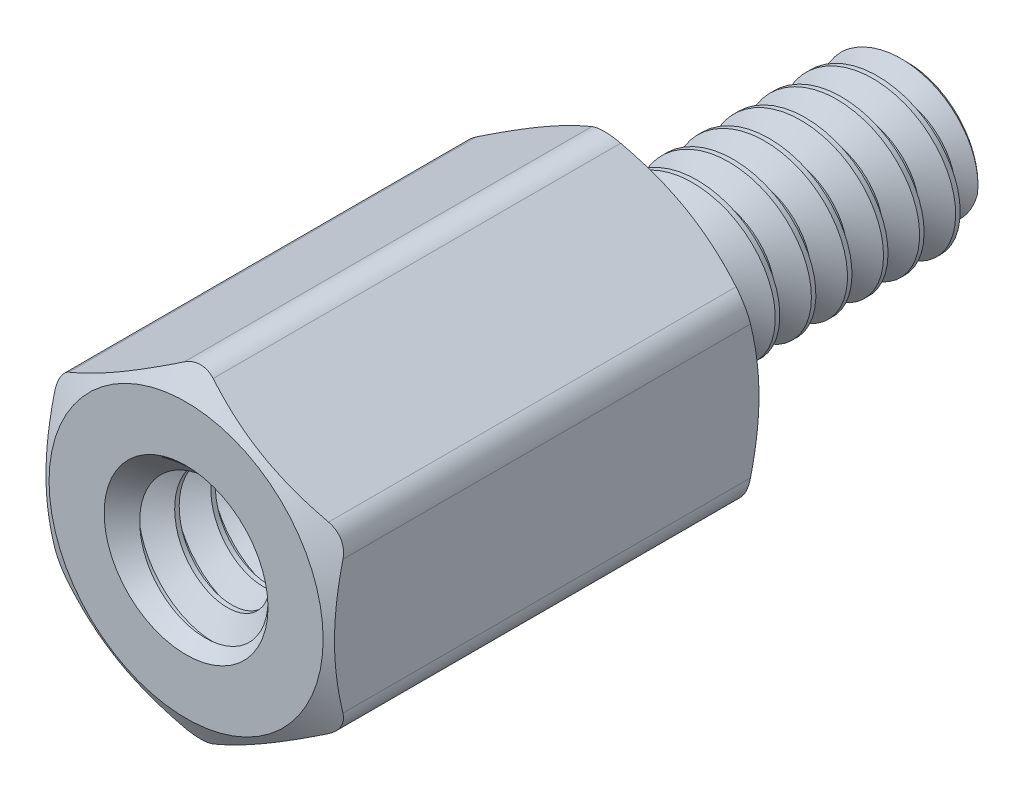
from build123d import *

# Parameters (mm, degrees)
SKETCH4_R              = 2.4638
BOSS_EXTRUDE1_DEPTH    = 9.525
SKETCH5_OUTSIDE_W      = 73.036
SKETCH5_OUTSIDE_H      = 74.018
SKETCH5_OUTSIDE_R      = 3.01625
CUT_EXTRUDE1_DEPTH     = 17.599309725
CUT_EXTRUDE1_DRAFT     = -60
SKETCH6_OUTSIDE_W      = 52.562
SKETCH6_OUTSIDE_H      = 53.544
SKETCH6_OUTSIDE_R      = 3.01625
CUT_EXTRUDE2_DEPTH     = 11.688642726
CUT_EXTRUDE2_DRAFT     = -60
FILLET1_R              = 0.635
CUT_SWEEP1_PITCH       = 0.79375
CUT_SWEEP1_HEIGHT      = 6.1595
CUT_SWEEP1_RADIUS      = 1.7526
CUT_SWEEP1_START_ANGLE = 90
SKETCH9_R              = 1.9510375
BOSS_EXTRUDE2_DEPTH    = 5.5626
SKETCH10_W             = 5.5626
SKETCH10_H             = 1.7526
CUT_SWEEP2_PITCH       = 0.79375
SKETCH13_R             = 1.8034
CUT_EXTRUDE3_DEPTH     = 1.190625
CUT_EXTRUDE3_DRAFT     = -44.758685511


with BuildPart() as part:
    # Sketch3 → Revolve1 (revolve)
    with BuildSketch(Plane(origin=(0, 0, 0), x_dir=(0, 0, -1), z_dir=(1, 0, 0))):
        with BuildLine():
            Line((-3.9624, 1.5541625), (-3.9624, 0))
            Line((-3.9624, 0), (6.35, 0))
            Line((6.35, 0), (6.35, 1.5541625))
            Line((6.35, 1.5541625), (6.1515625, 1.7526))
            Line((6.1515625, 1.7526), (1.05965625, 1.7526))
            Line((1.05965625, 1.7526), (0.762, 1.237044252))
            Line((0.762, 1.237044252), (0.1984375, 1.237044252))
            ThreePointArc((0.1984375, 1.237044252), (0.058120998, 1.29516525), (0, 1.435481752))
            Line((0, 1.435481752), (0, 3.175))
            Line((0, 3.175), (-9.525, 3.175))
            Line((-9.525, 3.175), (-9.525, 1.9510375))
            Line((-9.525, 1.9510375), (-9.3265625, 1.7526))
            Line((-9.3265625, 1.7526), (-4.1608375, 1.7526))
            Line((-4.1608375, 1.7526), (-3.9624, 1.5541625))
        make_face()
    revolve(axis=Axis((0, 0, -6.35), (0, 0, 1)))

    # Sketch4 → Boss-Extrude1 (add)
    with BuildSketch(Plane.XY.offset(9.525)):
        Polygon((-3.175, 1.833087105), (-3.175, -1.833087105), (0, -3.666174209), (3.175, -1.833087105), (3.175, 1.833087105), (0, 3.666174209), align=None)
        Circle(SKETCH4_R, mode=Mode.SUBTRACT)
    extrude(amount=-BOSS_EXTRUDE1_DEPTH)


with BuildPart() as cut_extrude1_tool:
    # Sketch5 outside → Cut-Extrude1 (with draft: the straight prism first)
    with BuildSketch(Plane.XY.offset(9.525)):
        Rectangle(SKETCH5_OUTSIDE_W, SKETCH5_OUTSIDE_H)
        Circle(SKETCH5_OUTSIDE_R, mode=Mode.SUBTRACT)
    extrude(amount=-CUT_EXTRUDE1_DEPTH)
    # Cut-Extrude1: the draft: its side faces are tilted about the plane it starts from
    cut_extrude1_sides = [cut_extrude1_tool.faces().sort_by_distance(p)[0] for p in [
        (0, -37.009, 0.725345138),
        (36.518, 0, 0.725345138),
        (0, 37.009, 0.725345138),
        (-36.518, 0, 0.725345138),
        (-3.01625, 0, 0.725345138),
    ]]
    draft(cut_extrude1_sides, Plane.XY.offset(9.525), CUT_EXTRUDE1_DRAFT)


with BuildPart() as part_1:
    add(part.part)

    # Cut-Extrude1: cut by cut_extrude1_tool
    add(cut_extrude1_tool.part, mode=Mode.SUBTRACT)


with BuildPart() as cut_extrude2_tool:
    # Sketch6 outside → Cut-Extrude2 (with draft: the straight prism first)
    with BuildSketch(Plane(origin=(0, 0, 0), x_dir=(-1, 0, 0), z_dir=(0, 0, -1))):
        Rectangle(SKETCH6_OUTSIDE_W, SKETCH6_OUTSIDE_H)
        Circle(SKETCH6_OUTSIDE_R, mode=Mode.SUBTRACT)
    extrude(amount=-CUT_EXTRUDE2_DEPTH)
    # Cut-Extrude2: the draft: its side faces are tilted about the plane it starts from
    cut_extrude2_sides = [cut_extrude2_tool.faces().sort_by_distance(p)[0] for p in [
        (0, -26.772, 5.844321363),
        (-26.281, 0, 5.844321363),
        (0, 26.772, 5.844321363),
        (26.281, 0, 5.844321363),
        (3.01625, 0, 5.844321363),
    ]]
    draft(cut_extrude2_sides, Plane(origin=(0, 0, 0), x_dir=(-1, 0, 0), z_dir=(0, 0, -1)), CUT_EXTRUDE2_DRAFT)


with BuildPart() as part_2:
    add(part_1.part)

    # Cut-Extrude2: cut by cut_extrude2_tool
    add(cut_extrude2_tool.part, mode=Mode.SUBTRACT)

    # Fillet1
    fillet1_edges = [part_2.edges().sort_by_distance(p)[0] for p in [
        (0, 3.666174209, 4.7625),
        (-3.175, -1.833087105, 4.7625),
        (0, -3.666174209, 4.7625),
        (3.175, -1.833087105, 4.7625),
        (3.175, 1.833087105, 4.7625),
        (-3.175, 1.833087105, 4.7625),
    ]]
    fillet(fillet1_edges, radius=FILLET1_R)

    # Cut-Sweep1: sweep along a helix
    with BuildLine() as cut_sweep1_path:
        add(Helix(CUT_SWEEP1_PITCH, CUT_SWEEP1_HEIGHT, CUT_SWEEP1_RADIUS, center=(0, 0, -6.35), direction=(0, 0, 1), mode=Mode.PRIVATE).rotate(Axis((0, 0, -6.35), (0, 0, 1)), CUT_SWEEP1_START_ANGLE))
    # Sketch7 → Cut-Sweep1 (sweep, cut)
    with BuildSketch(Plane.ZY):
        Polygon((-6.64765625, 1.237044252), (-6.746875, 1.237044252), (-7.069335938, 1.795562979), (-6.325195313, 1.795562979), align=None)
    sweep(path=cut_sweep1_path.line, is_frenet=True, mode=Mode.SUBTRACT)

    # Sketch9 → Boss-Extrude2 (add)
    with BuildSketch(Plane.XY.offset(3.9624)):
        Circle(SKETCH9_R)
    extrude(amount=BOSS_EXTRUDE2_DEPTH)


with BuildPart() as body_2:
    # Sketch10 → Revolve2 (revolve)
    with BuildSketch(Plane(origin=(0, 0, 0), x_dir=(0, 0, -1), z_dir=(1, 0, 0))):
        with Locations((-6.7437, 0.8763)):
            Rectangle(SKETCH10_W, SKETCH10_H)
    revolve(axis=Axis((0, 0, -6.35), (0, 0, 1)))

    # Cut-Sweep2: the profile of Sketch12 profile screwed along a right-hand helix of 8.008 turns, 8 arcs to a turn; built about Z, then put on its axis
    cut_sweep2_z = Axis((0, 0, 0), (0, 0, 1))
    cut_sweep2_corners = [(1.236744252, 0, -0.396701795), (1.236744252, 0, -0.297829455), (1.795562979, 0, 0.024804687), (1.795562979, 0, -0.719335938)]
    with BuildLine(mode=Mode.PRIVATE) as cut_sweep2_profile:
        Line(cut_sweep2_corners[0], cut_sweep2_corners[1])
        Line(cut_sweep2_corners[1], cut_sweep2_corners[2])
        Line(cut_sweep2_corners[2], cut_sweep2_corners[3])
        Line(cut_sweep2_corners[3], cut_sweep2_corners[0])
    cut_sweep2_cap = Face(cut_sweep2_profile.wire())
    cut_sweep2_turn_angles = [0, 22.5, 45, 67.5, 90, 112.5, 135, 157.5, 180, 202.5, 225, 247.5, 270, 292.5, 315, 337.5, 360]
    cut_sweep2_turn_weights = [1, 0.9238795325112867, 1, 0.9238795325112867, 1, 0.9238795325112867, 1, 0.9238795325112867, 1, 0.9238795325112867, 1, 0.9238795325112867, 1, 0.9238795325112867, 1, 0.9238795325112867, 1]
    cut_sweep2_turn_rails = [Edge.make_bspline([Vector(p[0], p[1], 0).rotate(cut_sweep2_z, cut_sweep2_turn_angles[k]) / cut_sweep2_turn_weights[k] + Vector(0, 0, p[2] + CUT_SWEEP2_PITCH * cut_sweep2_turn_angles[k] / 360) for k in range(17)], [0, 0, 0, 1, 1, 2, 2, 3, 3, 4, 4, 5, 5, 6, 6, 7, 7, 8, 8, 8], 2, cut_sweep2_turn_weights) for p in cut_sweep2_corners]
    cut_sweep2_turn_sides = [Face.make_surface_from_curves(cut_sweep2_turn_rails[p[0]], cut_sweep2_turn_rails[p[1]]) for p in [(0, 1), (1, 2), (2, 3), (3, 0)]]
    cut_sweep2_last_angles = [2880, 2881.44, 2882.88]
    cut_sweep2_last_weights = [1, 0.9996841892832979, 1]
    cut_sweep2_last_rails = [Edge.make_bspline([Vector(p[0], p[1], 0).rotate(cut_sweep2_z, cut_sweep2_last_angles[k]) / cut_sweep2_last_weights[k] + Vector(0, 0, p[2] + CUT_SWEEP2_PITCH * cut_sweep2_last_angles[k] / 360) for k in range(3)], [0, 0, 0, 1, 1, 1], 2, cut_sweep2_last_weights) for p in cut_sweep2_corners]
    cut_sweep2_last_sides = [Face.make_surface_from_curves(cut_sweep2_last_rails[p[0]], cut_sweep2_last_rails[p[1]]) for p in [(0, 1), (1, 2), (2, 3), (3, 0)]]
    cut_sweep2 = Plane(origin=(0, 0, 9.525), x_dir=(0, 1, 0), z_dir=(0, 0, -1)) * Solid(Shell([*[p.moved(Location((0, 0, CUT_SWEEP2_PITCH * i))) for i in range(8) for p in cut_sweep2_turn_sides], *cut_sweep2_last_sides, cut_sweep2_cap, cut_sweep2_cap.rotate(cut_sweep2_z, 2882.88).moved(Location((0, 0, CUT_SWEEP2_PITCH * 2882.88 / 360)))]))
    add(cut_sweep2, mode=Mode.SUBTRACT)


with BuildPart() as part_3:
    add(part_2.part)

    # Combine1: cut body 2
    add(body_2.part, mode=Mode.SUBTRACT)


with BuildPart() as cut_extrude3_tool:
    # Sketch13 → Cut-Extrude3 (with draft: the straight prism first)
    with BuildSketch(Plane.XY.offset(9.525)):
        Circle(SKETCH13_R)
    extrude(amount=-CUT_EXTRUDE3_DEPTH)
    # Cut-Extrude3: the draft: its side faces are tilted about the plane it starts from
    cut_extrude3_sides = [cut_extrude3_tool.faces().sort_by_distance(p)[0] for p in [
        (-1.8034, 0, 8.9296875),
    ]]
    draft(cut_extrude3_sides, Plane.XY.offset(9.525), CUT_EXTRUDE3_DRAFT)


with BuildPart() as part_4:
    add(part_3.part)

    # Cut-Extrude3: cut by cut_extrude3_tool
    add(cut_extrude3_tool.part, mode=Mode.SUBTRACT)


solid = part_4.part
